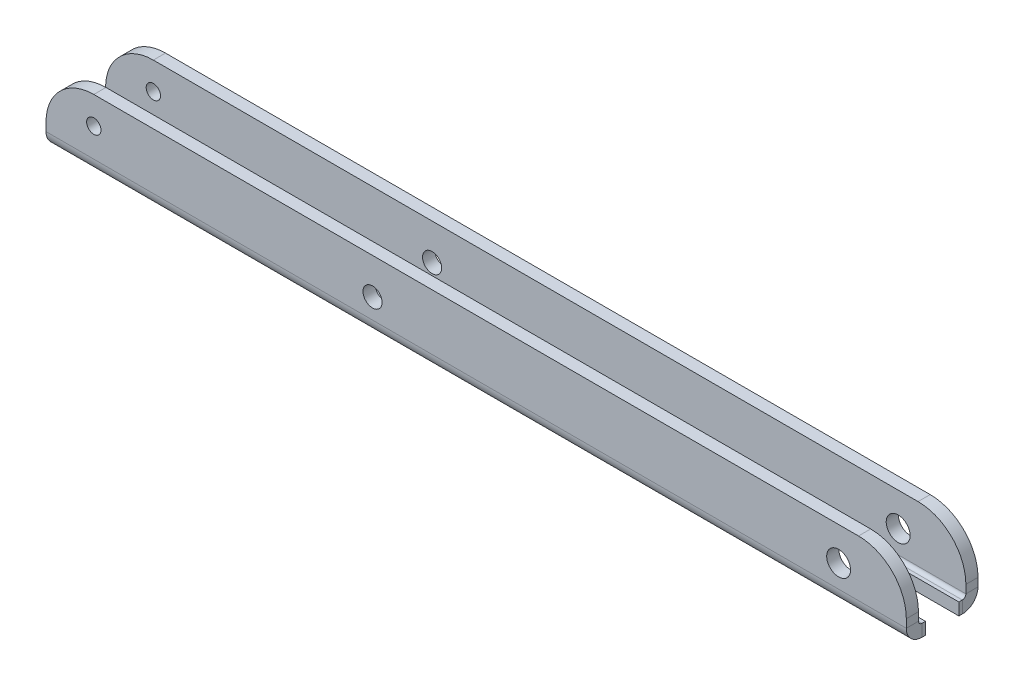
from build123d import *

# Parameters (mm, degrees)
SKETCH1_W                    = 180
SKETCH1_H                    = 15
BASE_FLANGE1_DEPTH           = 2.54
EDGE_FLANGE1_STRIP_W         = 11.6332
EDGE_FLANGE1_STRIP_H         = 2.54
EDGE_FLANGE1_STRIP_CUT_DEPTH = 180
EDGE_FLANGE1_DEPTH           = 180
EDGE_FLANGE2_STRIP_W         = 11.6332
EDGE_FLANGE2_STRIP_H         = 2.54
EDGE_FLANGE2_STRIP_CUT_DEPTH = 180
EDGE_FLANGE2_DEPTH           = 180
CUT_EXTRUDE3_DEPTH           = 92.167437169
CUT_EXTRUDE3_DEPTH_BACK      = 92.167437169
SKETCH12_R                   = 2.5
CUT_EXTRUDE4_DEPTH           = 92.167437169
CUT_EXTRUDE4_DEPTH_BACK      = 92.167437169
SKETCH16_R                   = 2
CUT_EXTRUDE6_DEPTH           = 92.549167118
FILLET1_R                    = 10
CUT_EXTRUDE7_DEPTH           = 93.088281556
CUT_EXTRUDE7_DEPTH_BACK      = 93.088281556
SKETCH18_R                   = 1.5


# Sheet-metal steps are written as plain solids
with BuildPart() as part:
    # Sketch1 → Base-Flange1 (new body)
    with BuildSketch(Plane(origin=(0, 0, 0), x_dir=(1, 0, 0), z_dir=(0, 1, 0))):
        Rectangle(SKETCH1_W, SKETCH1_H)
    extrude(amount=-BASE_FLANGE1_DEPTH)

    # Edge-Flange1 strip (across the edge) → Edge-Flange1 strip cut (cut)
    with BuildSketch(Plane(origin=(-90, 0, 7.5), x_dir=(0, 0, -1), z_dir=(1, 0, 0))):
        with Locations((-2.54, -1.27)):
            Rectangle(EDGE_FLANGE1_STRIP_W, EDGE_FLANGE1_STRIP_H)
    extrude(amount=EDGE_FLANGE1_STRIP_CUT_DEPTH, mode=Mode.SUBTRACT)

    # Edge-Flange1 section (across the edge) → Edge-Flange1 (add)
    with BuildSketch(Plane(origin=(-90, 0, 7.5), x_dir=(0, 0, -1), z_dir=(1, 0, 0))):
        with BuildLine():
            Line((0, 0.7366), (0, 12.46))
            Line((0, 12.46), (2.54, 12.46))
            Line((2.54, 12.46), (2.54, 0.7366))
            ThreePointArc((2.54, 0.7366), (2.755745145, 0.215745145), (3.2766, 0))
            Line((3.2766, 0), (3.2766, -2.54))
            ThreePointArc((3.2766, -2.54), (0.959693921, -1.580306079), (0, 0.7366))
        make_face()
    extrude(amount=EDGE_FLANGE1_DEPTH)

    # Edge-Flange2 strip (across the edge) → Edge-Flange2 strip cut (cut)
    with BuildSketch(Plane(origin=(90, 0, -7.5), x_dir=(0, 0, 1), z_dir=(-1, 0, 0))):
        with Locations((-2.54, -1.27)):
            Rectangle(EDGE_FLANGE2_STRIP_W, EDGE_FLANGE2_STRIP_H)
    extrude(amount=EDGE_FLANGE2_STRIP_CUT_DEPTH, mode=Mode.SUBTRACT)

    # Edge-Flange2 section (across the edge) → Edge-Flange2 (add)
    with BuildSketch(Plane(origin=(90, 0, -7.5), x_dir=(0, 0, 1), z_dir=(-1, 0, 0))):
        with BuildLine():
            Line((0, 0.7366), (0, 12.46))
            Line((0, 12.46), (2.54, 12.46))
            Line((2.54, 12.46), (2.54, 0.7366))
            ThreePointArc((2.54, 0.7366), (2.755745145, 0.215745145), (3.2766, 0))
            Line((3.2766, 0), (3.2766, -2.54))
            ThreePointArc((3.2766, -2.54), (0.959693921, -1.580306079), (0, 0.7366))
        make_face()
    extrude(amount=EDGE_FLANGE2_DEPTH)

    # Sketch12 → Cut-Extrude3 (cut, two sides: drawn at the far end of the back side and taken through both)
    with BuildSketch(Plane.XY.offset(-CUT_EXTRUDE3_DEPTH_BACK)):
        with Locations((75.835364308, 5.46)):
            Circle(SKETCH12_R)
    extrude(amount=CUT_EXTRUDE3_DEPTH + CUT_EXTRUDE3_DEPTH_BACK, mode=Mode.SUBTRACT)

    # Sketch16 → Cut-Extrude4 (cut, two sides: drawn at the far end of the back side and taken through both)
    with BuildSketch(Plane.XY.offset(-CUT_EXTRUDE4_DEPTH_BACK)):
        with Locations((-21.676425181, 4.934342186)):
            Circle(SKETCH16_R)
    extrude(amount=CUT_EXTRUDE4_DEPTH + CUT_EXTRUDE4_DEPTH_BACK, mode=Mode.SUBTRACT)

    # Sketch17 → Cut-Extrude6 (cut, through all)
    with BuildSketch(Plane.XZ.offset(2.54)):
        with BuildLine():
            Line((90, -3.5), (90, 3.5))
            Line((90, 3.5), (10, 3.5))
            ThreePointArc((10, 3.5), (12.474873734, 2.474873734), (13.5, 0))
            ThreePointArc((13.5, 0), (12.474873734, -2.474873734), (10, -3.5))
            Line((10, -3.5), (90, -3.5))
        make_face()
        with BuildLine():
            ThreePointArc((13.5, 0), (12.474873734, 2.474873734), (10, 3.5))
            Line((10, 3.5), (10, -3.5))
            ThreePointArc((10, -3.5), (12.474873734, -2.474873734), (13.5, 0))
        make_face()
        with BuildLine():
            Line((10, -3.5), (10, 3.5))
            ThreePointArc((10, 3.5), (6.5, 0), (10, -3.5))
        make_face()
    extrude(amount=-CUT_EXTRUDE6_DEPTH, mode=Mode.SUBTRACT)

    # Fillet1
    fillet1_edges = [part.edges().sort_by_distance(p)[0] for p in [
        (-90, 12.46, 6.23),
        (90, 12.46, 6.23),
        (90, 12.46, -6.23),
        (-90, 12.46, -6.23),
    ]]
    fillet(fillet1_edges, radius=FILLET1_R)

    # Sketch18 → Cut-Extrude7 (cut, two sides: drawn at the far end of the back side and taken through both)
    with BuildSketch(Plane(origin=(0, 0, -7.5), x_dir=(-1, 0, 0), z_dir=(0, 0, -1)).offset(-CUT_EXTRUDE7_DEPTH_BACK)):
        with Locations(Location((80, 6.7366, 0), (0, 0, 270))):
            Circle(SKETCH18_R)
    extrude(amount=CUT_EXTRUDE7_DEPTH + CUT_EXTRUDE7_DEPTH_BACK, mode=Mode.SUBTRACT)


solid = part.part
